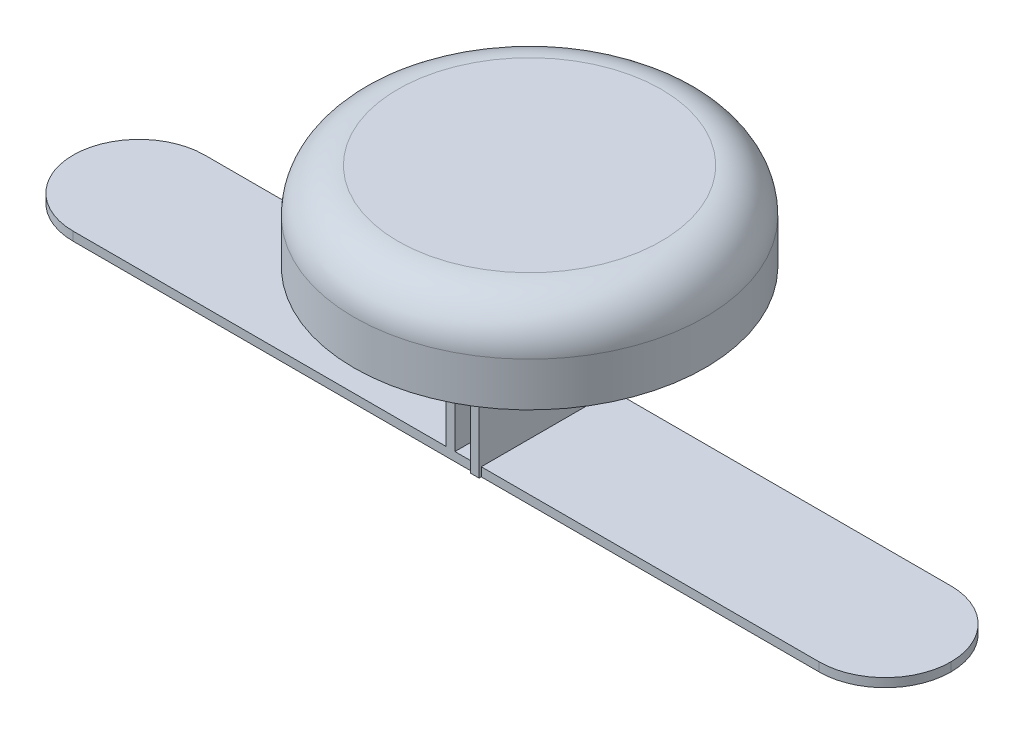
from build123d import *

# Parameters (mm, degrees)
ESQUISSE1_R             = 4
BOSS_EXTRU_1_DEPTH      = 2
CONG_1_R                = 1
ESQUISSE2_W             = 0.2
ESQUISSE2_H             = 3
BOSS_EXTRU_2_DEPTH      = 3.2
BOSS_EXTRU_3_DEPTH      = 10
BOSS_EXTRU_3_DEPTH_BACK = 10
ESQUISSE3_W             = 3
ESQUISSE3_H             = 0.2
CONG_2_R                = 1.5


with BuildPart() as part:
    # Esquisse1 → Boss.-Extru.1 (new body)
    with BuildSketch(Plane(origin=(0, 0, 0), x_dir=(1, 0, 0), z_dir=(0, 1, 0))):
        with Locations(Location((0, 0, 0), (0, 0, 270))):
            Circle(ESQUISSE1_R)
    extrude(amount=BOSS_EXTRU_1_DEPTH)

    # Congé1
    cong_1_edges = [part.edges().sort_by_distance(p)[0] for p in [
        (0, 2, -4),
    ]]
    fillet(cong_1_edges, radius=CONG_1_R)

    # Esquisse2 → Boss.-Extru.2 (add)
    with BuildSketch(Plane.XZ):
        with Locations((-0.3, 0)):
            Rectangle(ESQUISSE2_W, ESQUISSE2_H)
        with Locations((0.3, 0.05)):
            Rectangle(ESQUISSE2_W, ESQUISSE2_H)
    extrude(amount=BOSS_EXTRU_2_DEPTH)

    # Esquisse3 → Boss.-Extru.3 (add, two sides: drawn at the far end of the back side and taken through both)
    with BuildSketch(Plane.ZY.offset(0.4).offset(-BOSS_EXTRU_3_DEPTH_BACK)):
        with Locations((0, -3.1)):
            Rectangle(ESQUISSE3_W, ESQUISSE3_H)
    extrude(amount=BOSS_EXTRU_3_DEPTH + BOSS_EXTRU_3_DEPTH_BACK)

    # Congé2
    cong_2_edges = [part.edges().sort_by_distance(p)[0] for p in [
        (9.6, -3.1, -1.5),
        (9.6, -3.1, 1.5),
        (-10.4, -3.1, 1.5),
        (-10.4, -3.1, -1.5),
    ]]
    fillet(cong_2_edges, radius=CONG_2_R - 0.0001)  # a hair under: the kernel refuses the full size


solid = part.part
